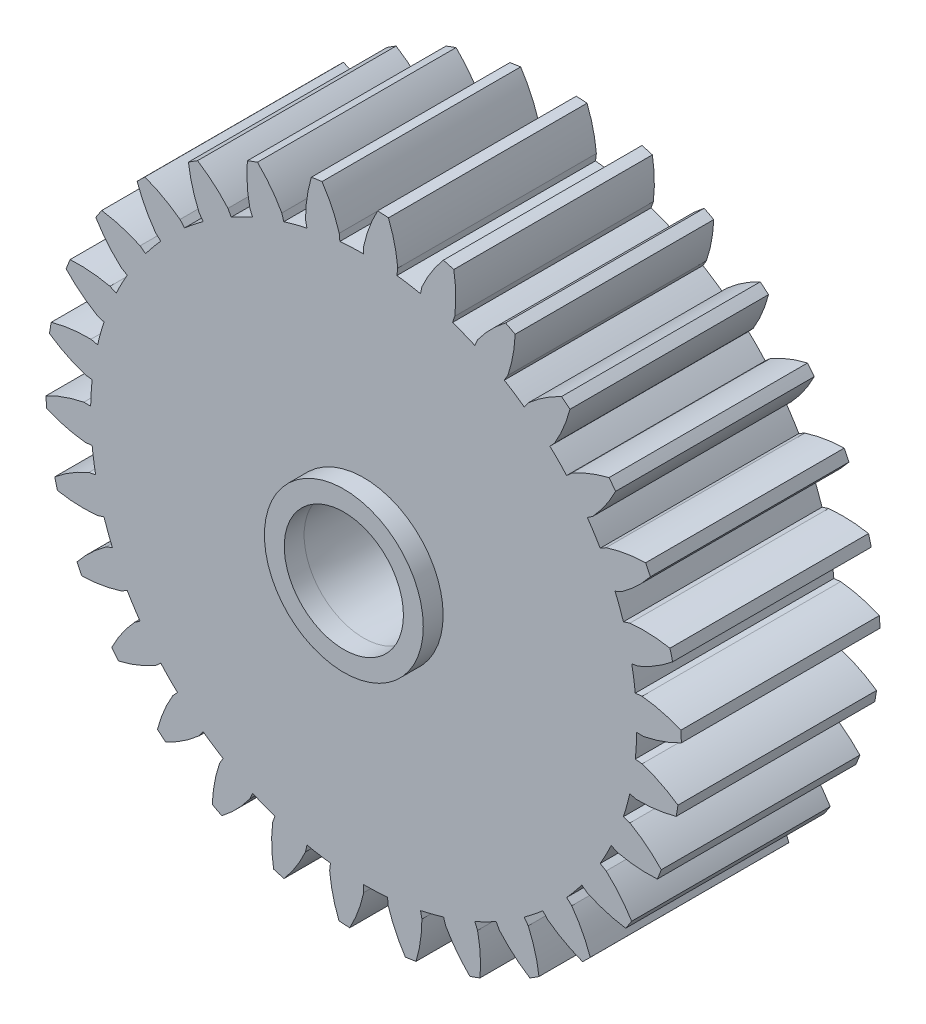
from build123d import *

# Parameters (mm, degrees)
ESQUISSE1_R                  = 13.75
BOSS_EXTRU_2_DEPTH           = 10
BOSS_EXTRU_3_DEPTH           = 10
R_P_TITION_CIRCULAIRE1_COUNT = 30
ESQUISSE4_R                  = 3
SHAFT_DEPTH                  = 10
SHAFT_DRAFT                  = -2
ESQUISSE5_R                  = 4
ESQUISSE5_R_2                = 3
SHOULDER_DEPTH               = 1


# Read off the part's stored shape, not the designer's step: Coque1
with BuildPart() as part:
    # Esquisse1 → Boss.-Extru.2 (new body)
    with BuildSketch(Plane.XY):
        Circle(ESQUISSE1_R)
    extrude(amount=BOSS_EXTRU_2_DEPTH)

    # Esquisse3 → Boss.-Extru.3 (add)
    with BuildSketch(Plane.XY):
        with BuildLine():
            Line((1.714641293, 13.990711386), (1.672626222, 13.647887072))
            ThreePointArc((1.672626222, 13.647887072), (0.837870146, 13.724448026), (0, 13.75))
            Line((0, 13.75), (0, 14.095389312))
            ThreePointArc((0, 14.095389312), (0.283174668, 15.065398557), (0.703020934, 15.984547587))
            ThreePointArc((0.703020934, 15.984547587), (0.97497617, 15.970266794), (1.246648955, 15.95135939))
            ThreePointArc((1.246648955, 15.95135939), (1.551566893, 14.987963896), (1.714641293, 13.990711386))
        make_face()
    boss_extru_3 = extrude(amount=BOSS_EXTRU_3_DEPTH)

    # Répétition circulaire1: Boss.-Extru.3 ×30 about axis
    r_p_tition_circulaire1_axis = Axis((0, 0, 0), (0, 0, 1))
    for i in range(1, R_P_TITION_CIRCULAIRE1_COUNT):
        add(boss_extru_3.rotate(r_p_tition_circulaire1_axis, i * 360 / R_P_TITION_CIRCULAIRE1_COUNT))


with BuildPart() as shaft_tool:
    # Esquisse4 → shaft (with draft: the straight prism first)
    with BuildSketch(Plane.XY.offset(10)):
        Circle(ESQUISSE4_R)
    extrude(amount=-SHAFT_DEPTH)
    # shaft: the draft: its side faces are tilted about the plane it starts from
    shaft_sides = [shaft_tool.faces().sort_by_distance(p)[0] for p in [
        (-3, 0, 5),
    ]]
    draft(shaft_sides, Plane.XY.offset(10), SHAFT_DRAFT)


with BuildPart() as part_1:
    add(part.part)

    # shaft: cut by shaft_tool
    add(shaft_tool.part, mode=Mode.SUBTRACT)

    # Esquisse5 → shoulder (add)
    with BuildSketch(Plane.XY.offset(10)):
        Circle(ESQUISSE5_R)
        Circle(ESQUISSE5_R_2, mode=Mode.SUBTRACT)
    extrude(amount=SHOULDER_DEPTH)

    # Coque1 outline → Coque1 (revolve, cut)
    with BuildSketch(Plane.XZ):
        Polygon((4.93137755, 8), (4.652011394, 0), (11.75, 0), (11.75, 8), align=None)
    revolve(axis=Axis((0, 0, 0), (0, 0, 1)), mode=Mode.SUBTRACT)


solid = part_1.part
